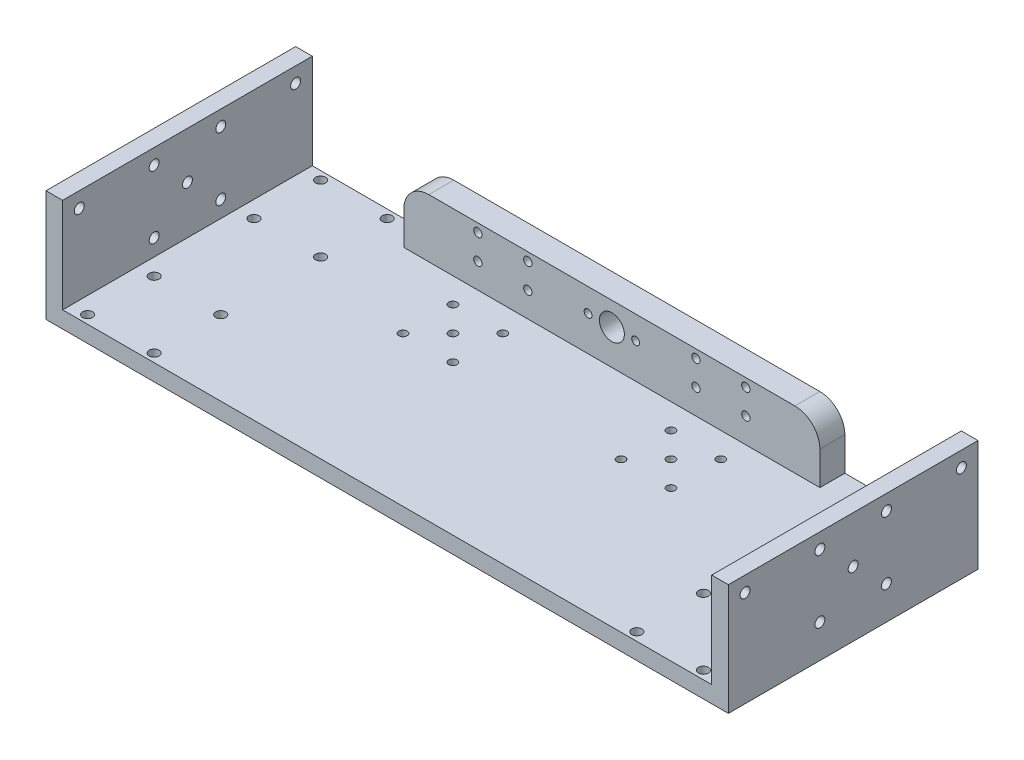
from build123d import *

# Parameters (mm, degrees)
SKETCH1_W            = 410
SKETCH1_H            = 150
SKETCH1_R            = 3
BOSS_EXTRUDE1_DEPTH  = 10
SKETCH2_W            = 10
SKETCH2_H            = 150
BOSS_EXTRUDE3_DEPTH  = 60
SKETCH3_W            = 250
SKETCH3_H            = 10
BOSS_EXTRUDE4_DEPTH  = 60
FILLET2_R            = 25
SKETCH4_R            = 7.5
CUT_EXTRUDE1_DEPTH   = 60
SKETCH5_R            = 3
CUT_EXTRUDE2_DEPTH   = 500
SKETCH6_R            = 3
CUT_EXTRUDE3_DEPTH   = 10
SKETCH7_R            = 3
BOSS_EXTRUDE5_DEPTH  = 10
CUT_EXTRUDE4_START   = -10
SKETCH8_R            = 3
CUT_EXTRUDE4_DEPTH   = 10
BOSS_EXTRUDE6_START  = -10
SKETCH9_R            = 3
BOSS_EXTRUDE6_DEPTH  = 10
SKETCH10_W           = 150
SKETCH10_H           = 3
CUT_EXTRUDE5_DEPTH   = 600
SKETCH11_R           = 2.5
CUT_EXTRUDE6_DEPTH   = 448.759980347
SKETCH12_R           = 2.5
CUT_EXTRUDE7_DEPTH   = 10
SKETCH14_R           = 2.5
CUT_EXTRUDE8_DEPTH   = 10
SKETCH16_R           = 2.5
CUT_EXTRUDE9_DEPTH   = 10
SKETCH17_R           = 2.5
BOSS_EXTRUDE7_DEPTH  = 10
SKETCH18_R           = 2.5
SKETCH18_R_2         = 7.5
BOSS_EXTRUDE8_DEPTH  = 5
FILLET3_R            = 22
FILLET4_R            = 22
BOSS_EXTRUDE9_DEPTH  = 5
CUT_EXTRUDE11_DEPTH  = 5
CUT_EXTRUDE12_START  = -5
SKETCH21_R           = 2.5
SKETCH21_R_2         = 7.5
CUT_EXTRUDE12_DEPTH  = 5
BOSS_EXTRUDE10_START = 5
SKETCH22_W           = 250
SKETCH22_H           = 57
SKETCH22_R           = 2.5
SKETCH22_R_2         = 7.5
BOSS_EXTRUDE10_DEPTH = 5
FILLET5_R            = 22
SKETCH23_R           = 2.5
BOSS_EXTRUDE12_DEPTH = 5
SKETCH24_R           = 2.5
BOSS_EXTRUDE13_DEPTH = 10
CUT_EXTRUDE19_START  = -10
SKETCH25_R           = 2.5
CUT_EXTRUDE19_DEPTH  = 10
SKETCH27_W           = 250
SKETCH27_H           = 15
CUT_EXTRUDE20_DEPTH  = 22
SKETCH28_R           = 2.5
CUT_EXTRUDE21_DEPTH  = 22
FILLET6_R            = 15
FILLET7_R            = 15
SKETCH30_R           = 2.5
SKETCH30_R_2         = 2.34
BOSS_EXTRUDE15_DEPTH = 15
SKETCH32_R           = 2.5
BOSS_EXTRUDE17_DEPTH = 15


with BuildPart() as part:
    # Sketch1 → Boss-Extrude1 (new body)
    with BuildSketch(Plane(origin=(0, 0, 0), x_dir=(1, 0, 0), z_dir=(0, 1, 0))):
        with Locations((215, 75)):
            Rectangle(SKETCH1_W, SKETCH1_H)
        with Locations(Location((30, 5, 0), (0, 0, 270))):
            Circle(SKETCH1_R, mode=Mode.SUBTRACT)
        with Locations(Location((70, 5, 0), (0, 0, 270))):
            Circle(SKETCH1_R, mode=Mode.SUBTRACT)
        with Locations(Location((30, 45, 0), (0, 0, 270))):
            Circle(SKETCH1_R, mode=Mode.SUBTRACT)
        with Locations(Location((70, 45, 0), (0, 0, 270))):
            Circle(SKETCH1_R, mode=Mode.SUBTRACT)
        with Locations(Location((360, 5, 0), (0, 0, 270))):
            Circle(SKETCH1_R, mode=Mode.SUBTRACT)
        with Locations(Location((400, 5, 0), (0, 0, 270))):
            Circle(SKETCH1_R, mode=Mode.SUBTRACT)
        with Locations(Location((360, 45, 0), (0, 0, 270))):
            Circle(SKETCH1_R, mode=Mode.SUBTRACT)
        with Locations(Location((400, 45, 0), (0, 0, 270))):
            Circle(SKETCH1_R, mode=Mode.SUBTRACT)
        with Locations(Location((30, 105, 0), (0, 0, 270))):
            Circle(SKETCH1_R, mode=Mode.SUBTRACT)
        with Locations(Location((70, 105, 0), (0, 0, 270))):
            Circle(SKETCH1_R, mode=Mode.SUBTRACT)
        with Locations(Location((30, 145, 0), (0, 0, 270))):
            Circle(SKETCH1_R, mode=Mode.SUBTRACT)
        with Locations(Location((70, 145, 0), (0, 0, 270))):
            Circle(SKETCH1_R, mode=Mode.SUBTRACT)
        with Locations(Location((360, 105, 0), (0, 0, 270))):
            Circle(SKETCH1_R, mode=Mode.SUBTRACT)
        with Locations(Location((400, 105, 0), (0, 0, 270))):
            Circle(SKETCH1_R, mode=Mode.SUBTRACT)
        with Locations(Location((360, 145, 0), (0, 0, 270))):
            Circle(SKETCH1_R, mode=Mode.SUBTRACT)
        with Locations(Location((400, 145, 0), (0, 0, 270))):
            Circle(SKETCH1_R, mode=Mode.SUBTRACT)
    extrude(amount=BOSS_EXTRUDE1_DEPTH)

    # Sketch2 → Boss-Extrude3 (add)
    with BuildSketch(Plane(origin=(0, 10, 0), x_dir=(1, 0, 0), z_dir=(0, 1, 0))):
        with Locations((15, 75)):
            Rectangle(SKETCH2_W, SKETCH2_H)
        with Locations((415, 75)):
            Rectangle(SKETCH2_W, SKETCH2_H)
    extrude(amount=BOSS_EXTRUDE3_DEPTH)

    # Sketch3 → Boss-Extrude4 (add)
    with BuildSketch(Plane(origin=(0, 10, 0), x_dir=(1, 0, 0), z_dir=(0, 1, 0))):
        with Locations((215, 145)):
            Rectangle(SKETCH3_W, SKETCH3_H)
    extrude(amount=BOSS_EXTRUDE4_DEPTH)

    # Fillet2
    fillet2_edges = [part.edges().sort_by_distance(p)[0] for p in [
        (340, 70, -145),
        (90, 70, -145),
    ]]
    fillet(fillet2_edges, radius=FILLET2_R)

    # Sketch4 → Cut-Extrude1 (cut)
    with BuildSketch(Plane.XY.offset(-140)):
        with Locations((215, 31)):
            Circle(SKETCH4_R)
    extrude(amount=-CUT_EXTRUDE1_DEPTH, mode=Mode.SUBTRACT)

    # Sketch5 → Cut-Extrude2 (cut)
    with BuildSketch(Plane(origin=(420, 0, 0), x_dir=(0, 0, -1), z_dir=(1, 0, 0))):
        with Locations((10, 57.828527729)):
            Circle(SKETCH5_R)
        with Locations((55, 57.828527729)):
            Circle(SKETCH5_R)
        with Locations((95, 57.828527729)):
            Circle(SKETCH5_R)
        with Locations((130, 57.828527729)):
            Circle(SKETCH5_R)
        with Locations((75, 38.914263864)):
            Circle(SKETCH5_R)
        with Locations((95, 20)):
            Circle(SKETCH5_R)
        with Locations((55, 20)):
            Circle(SKETCH5_R)
    extrude(amount=-CUT_EXTRUDE2_DEPTH, mode=Mode.SUBTRACT)

    # Sketch6 → Cut-Extrude3 (cut)
    with BuildSketch(Plane(origin=(420, 0, 0), x_dir=(0, 0, -1), z_dir=(1, 0, 0))):
        with Locations((140, 57.828527729)):
            Circle(SKETCH6_R)
    extrude(amount=-CUT_EXTRUDE3_DEPTH, mode=Mode.SUBTRACT)

    # Sketch7 → Boss-Extrude5 (add)
    with BuildSketch(Plane(origin=(420, 0, 0), x_dir=(0, 0, -1), z_dir=(1, 0, 0))):
        with Locations((130, 57.828527729)):
            Circle(SKETCH7_R)
    extrude(amount=-BOSS_EXTRUDE5_DEPTH)

    # Sketch8 → Cut-Extrude4 (cut)
    with BuildSketch(Plane.ZY.offset(-10).offset(CUT_EXTRUDE4_START)):
        with Locations(Location((-140, 57.828527729, 0), (0, 0, 180))):
            Circle(SKETCH8_R)
    extrude(amount=CUT_EXTRUDE4_DEPTH, mode=Mode.SUBTRACT)

    # Sketch9 → Boss-Extrude6 (add)
    with BuildSketch(Plane.ZY.offset(-10).offset(BOSS_EXTRUDE6_START)):
        with Locations((-130, 57.828527729)):
            Circle(SKETCH9_R)
    extrude(amount=BOSS_EXTRUDE6_DEPTH)

    # Sketch10 → Cut-Extrude5 (cut)
    with BuildSketch(Plane.ZY.offset(-10)):
        with Locations((-75, 68.5)):
            Rectangle(SKETCH10_W, SKETCH10_H)
    extrude(amount=-CUT_EXTRUDE5_DEPTH, mode=Mode.SUBTRACT)

    # Sketch11 → Cut-Extrude6 (cut, through all)
    with BuildSketch(Plane.XY.offset(-140)):
        with Locations((200.72, 31)):
            Circle(SKETCH11_R)
        with Locations((229.28, 31)):
            Circle(SKETCH11_R)
    extrude(amount=-CUT_EXTRUDE6_DEPTH, mode=Mode.SUBTRACT)

    # Sketch12 → Cut-Extrude7 (cut)
    with BuildSketch(Plane.XY.offset(-140)):
        with Locations((134.5, 55)):
            Circle(SKETCH12_R)
        with Locations((164.5, 55)):
            Circle(SKETCH12_R)
        with Locations((149.5, 40)):
            Circle(SKETCH12_R)
        with Locations((134.5, 25)):
            Circle(SKETCH12_R)
        with Locations((164.5, 25)):
            Circle(SKETCH12_R)
        with Locations((265.5, 55)):
            Circle(SKETCH12_R)
        with Locations((295.5, 55)):
            Circle(SKETCH12_R)
        with Locations((280.5, 40)):
            Circle(SKETCH12_R)
        with Locations((295.5, 25)):
            Circle(SKETCH12_R)
        with Locations((265.5, 25)):
            Circle(SKETCH12_R)
    extrude(amount=-CUT_EXTRUDE7_DEPTH, mode=Mode.SUBTRACT)

    # Sketch14 → Cut-Extrude8 (cut)
    with BuildSketch(Plane(origin=(0, 10, 0), x_dir=(1, 0, 0), z_dir=(0, 1, 0))):
        with Locations(Location((144.5, 125, 0), (0, 0, 270))):
            Circle(SKETCH14_R)
        with Locations(Location((174.5, 125, 0), (0, 0, 270))):
            Circle(SKETCH14_R)
        with Locations(Location((159.5, 110, 0), (0, 0, 270))):
            Circle(SKETCH14_R)
        with Locations(Location((174.5, 95, 0), (0, 0, 270))):
            Circle(SKETCH14_R)
        with Locations(Location((144.5, 95, 0), (0, 0, 270))):
            Circle(SKETCH14_R)
        with Locations(Location((255.5, 125, 0), (0, 0, 270))):
            Circle(SKETCH14_R)
        with Locations(Location((285.5, 125, 0), (0, 0, 270))):
            Circle(SKETCH14_R)
        with Locations(Location((270.5, 110, 0), (0, 0, 270))):
            Circle(SKETCH14_R)
        with Locations(Location((255.5, 95, 0), (0, 0, 270))):
            Circle(SKETCH14_R)
        with Locations(Location((285.5, 95, 0), (0, 0, 270))):
            Circle(SKETCH14_R)
    extrude(amount=-CUT_EXTRUDE8_DEPTH, mode=Mode.SUBTRACT)

    # Sketch16 → Cut-Extrude9 (cut)
    with BuildSketch(Plane(origin=(0, 10, 0), x_dir=(1, 0, 0), z_dir=(0, 1, 0))):
        with Locations(Location((164.5, 125, 0), (0, 0, 270))):
            Circle(SKETCH16_R)
        with Locations(Location((149.5, 110, 0), (0, 0, 270))):
            Circle(SKETCH16_R)
        with Locations(Location((164.5, 95, 0), (0, 0, 270))):
            Circle(SKETCH16_R)
        with Locations(Location((134.5, 95, 0), (0, 0, 270))):
            Circle(SKETCH16_R)
        with Locations(Location((134.5, 125, 0), (0, 0, 270))):
            Circle(SKETCH16_R)
        with Locations(Location((265.5, 125, 0), (0, 0, 270))):
            Circle(SKETCH16_R)
        with Locations(Location((280.5, 110, 0), (0, 0, 270))):
            Circle(SKETCH16_R)
        with Locations(Location((295.5, 125, 0), (0, 0, 270))):
            Circle(SKETCH16_R)
        with Locations(Location((265.5, 95, 0), (0, 0, 270))):
            Circle(SKETCH16_R)
        with Locations(Location((295.5, 95, 0), (0, 0, 270))):
            Circle(SKETCH16_R)
    extrude(amount=-CUT_EXTRUDE9_DEPTH, mode=Mode.SUBTRACT)

    # Sketch17 → Boss-Extrude7 (add)
    with BuildSketch(Plane(origin=(0, 10, 0), x_dir=(1, 0, 0), z_dir=(0, 1, 0))):
        with Locations((144.5, 125)):
            Circle(SKETCH17_R)
        with Locations((174.5, 125)):
            Circle(SKETCH17_R)
        with Locations((159.5, 110)):
            Circle(SKETCH17_R)
        with Locations((144.5, 95)):
            Circle(SKETCH17_R)
        with Locations((174.5, 95)):
            Circle(SKETCH17_R)
        with Locations((285.5, 125)):
            Circle(SKETCH17_R)
        with Locations((255.5, 125)):
            Circle(SKETCH17_R)
        with Locations((270.5, 110)):
            Circle(SKETCH17_R)
        with Locations((255.5, 95)):
            Circle(SKETCH17_R)
        with Locations((285.5, 95)):
            Circle(SKETCH17_R)
    extrude(amount=-BOSS_EXTRUDE7_DEPTH)

    # Sketch18 → Boss-Extrude8 (add)
    with BuildSketch(Plane(origin=(0, 0, -150), x_dir=(-1, 0, 0), z_dir=(0, 0, -1))):
        Polygon((-340, 10), (-410, 10), (-410, 67), (-420, 67), (-420, 0), (-10, 0), (-10, 67), (-20, 67), (-20, 10), (-90, 10), (-90, 67), (-340, 67), align=None)
        with Locations(Location((-295.5, 55, 0), (0, 0, 180))):
            Circle(SKETCH18_R, mode=Mode.SUBTRACT)
        with Locations(Location((-280.5, 40, 0), (0, 0, 180))):
            Circle(SKETCH18_R, mode=Mode.SUBTRACT)
        with Locations(Location((-265.5, 55, 0), (0, 0, 180))):
            Circle(SKETCH18_R, mode=Mode.SUBTRACT)
        with Locations(Location((-295.5, 25, 0), (0, 0, 180))):
            Circle(SKETCH18_R, mode=Mode.SUBTRACT)
        with Locations(Location((-265.5, 25, 0), (0, 0, 180))):
            Circle(SKETCH18_R, mode=Mode.SUBTRACT)
        with Locations(Location((-229.28, 31, 0), (0, 0, 180))):
            Circle(SKETCH18_R, mode=Mode.SUBTRACT)
        with Locations(Location((-215, 31, 0), (0, 0, 180))):
            Circle(SKETCH18_R_2, mode=Mode.SUBTRACT)
        with Locations(Location((-200.72, 31, 0), (0, 0, 180))):
            Circle(SKETCH18_R, mode=Mode.SUBTRACT)
        with Locations(Location((-164.5, 55, 0), (0, 0, 180))):
            Circle(SKETCH18_R, mode=Mode.SUBTRACT)
        with Locations(Location((-134.5, 55, 0), (0, 0, 180))):
            Circle(SKETCH18_R, mode=Mode.SUBTRACT)
        with Locations(Location((-149.5, 40, 0), (0, 0, 180))):
            Circle(SKETCH18_R, mode=Mode.SUBTRACT)
        with Locations(Location((-134.5, 25, 0), (0, 0, 180))):
            Circle(SKETCH18_R, mode=Mode.SUBTRACT)
        with Locations(Location((-164.5, 25, 0), (0, 0, 180))):
            Circle(SKETCH18_R, mode=Mode.SUBTRACT)
    extrude(amount=BOSS_EXTRUDE8_DEPTH)

    # Fillet3
    # the kernel refuses this fillet: 22 mm, written as the material it takes off along each edge
    with BuildSketch(Plane(origin=(340, 67, -95), x_dir=(0, -1, 0), z_dir=(0, 0, -1))) as fillet3_piece_1:
        with BuildLine():
            CenterArc((FILLET3_R, FILLET3_R), FILLET3_R, 180, 90)
            Line((0, FILLET3_R), (0, 0))
            Line((0, 0), (FILLET3_R, 0))
        make_face()
    extrude(amount=115, mode=Mode.SUBTRACT)

    # Fillet4
    # the kernel refuses this fillet: 22 mm, written as the material it takes off along each edge
    with BuildSketch(Plane(origin=(90, 67, -95), x_dir=(0, -1, 0), z_dir=(0, 0, -1))) as fillet4_piece_1:
        with BuildLine():
            CenterArc((FILLET4_R, -FILLET4_R), FILLET4_R, 90, 90)
            Line((0, -FILLET4_R), (0, 0))
            Line((0, 0), (FILLET4_R, 0))
        make_face()
    extrude(amount=115, mode=Mode.SUBTRACT)

    # Sketch19 → Boss-Extrude9 (add)
    with BuildSketch(Plane.XY):
        Polygon((10, 67), (20, 67), (20, 10), (410, 10), (410, 67), (420, 67), (420, 0), (10, 0), align=None)
    extrude(amount=BOSS_EXTRUDE9_DEPTH)

    # Sketch20 → Cut-Extrude11 (cut)
    with BuildSketch(Plane.XY.offset(5)):
        Polygon((10, 67), (20, 67), (20, 10), (410, 10), (410, 67), (420, 67), (420, 0), (10, 0), align=None)
    extrude(amount=-CUT_EXTRUDE11_DEPTH, mode=Mode.SUBTRACT)

    # Sketch21 → Cut-Extrude12 (cut)
    with BuildSketch(Plane(origin=(0, 0, -155), x_dir=(-1, 0, 0), z_dir=(0, 0, -1)).offset(CUT_EXTRUDE12_START)):
        Polygon((-420, 67), (-410, 67), (-410, 10), (-340, 10), (-340, 67), (-90, 67), (-90, 10), (-20, 10), (-20, 67), (-10, 67), (-10, 0), (-420, 0), align=None)
        with Locations(Location((-295.5, 55, 0), (0, 0, 180))):
            Circle(SKETCH21_R, mode=Mode.SUBTRACT)
        with Locations(Location((-265.5, 55, 0), (0, 0, 180))):
            Circle(SKETCH21_R, mode=Mode.SUBTRACT)
        with Locations(Location((-215, 31, 0), (0, 0, 180))):
            Circle(SKETCH21_R_2, mode=Mode.SUBTRACT)
        with Locations(Location((-200.72, 31, 0), (0, 0, 180))):
            Circle(SKETCH21_R, mode=Mode.SUBTRACT)
        with Locations(Location((-229.28, 31, 0), (0, 0, 180))):
            Circle(SKETCH21_R, mode=Mode.SUBTRACT)
        with Locations(Location((-265.5, 25, 0), (0, 0, 180))):
            Circle(SKETCH21_R, mode=Mode.SUBTRACT)
        with Locations(Location((-280.5, 40, 0), (0, 0, 180))):
            Circle(SKETCH21_R, mode=Mode.SUBTRACT)
        with Locations(Location((-295.5, 25, 0), (0, 0, 180))):
            Circle(SKETCH21_R, mode=Mode.SUBTRACT)
        with Locations(Location((-164.5, 55, 0), (0, 0, 180))):
            Circle(SKETCH21_R, mode=Mode.SUBTRACT)
        with Locations(Location((-149.5, 40, 0), (0, 0, 180))):
            Circle(SKETCH21_R, mode=Mode.SUBTRACT)
        with Locations(Location((-164.5, 25, 0), (0, 0, 180))):
            Circle(SKETCH21_R, mode=Mode.SUBTRACT)
        with Locations(Location((-134.5, 25, 0), (0, 0, 180))):
            Circle(SKETCH21_R, mode=Mode.SUBTRACT)
        with Locations(Location((-134.5, 55, 0), (0, 0, 180))):
            Circle(SKETCH21_R, mode=Mode.SUBTRACT)
    extrude(amount=CUT_EXTRUDE12_DEPTH, mode=Mode.SUBTRACT)

    # Sketch22 → Boss-Extrude10 (add)
    with BuildSketch(Plane.XY.offset(-140).offset(BOSS_EXTRUDE10_START)):
        with Locations((215, 38.5)):
            Rectangle(SKETCH22_W, SKETCH22_H)
        with Locations((134.5, 55)):
            Circle(SKETCH22_R, mode=Mode.SUBTRACT)
        with Locations((164.5, 55)):
            Circle(SKETCH22_R, mode=Mode.SUBTRACT)
        with Locations((149.5, 40)):
            Circle(SKETCH22_R, mode=Mode.SUBTRACT)
        with Locations((164.5, 25)):
            Circle(SKETCH22_R, mode=Mode.SUBTRACT)
        with Locations((134.5, 25)):
            Circle(SKETCH22_R, mode=Mode.SUBTRACT)
        with Locations((215, 31)):
            Circle(SKETCH22_R_2, mode=Mode.SUBTRACT)
        with Locations((229.28, 31)):
            Circle(SKETCH22_R, mode=Mode.SUBTRACT)
        with Locations((200.72, 31)):
            Circle(SKETCH22_R, mode=Mode.SUBTRACT)
        with Locations((265.5, 55)):
            Circle(SKETCH22_R, mode=Mode.SUBTRACT)
        with Locations((280.5, 40)):
            Circle(SKETCH22_R, mode=Mode.SUBTRACT)
        with Locations((295.5, 55)):
            Circle(SKETCH22_R, mode=Mode.SUBTRACT)
        with Locations((295.5, 25)):
            Circle(SKETCH22_R, mode=Mode.SUBTRACT)
        with Locations((265.5, 25)):
            Circle(SKETCH22_R, mode=Mode.SUBTRACT)
    extrude(amount=-BOSS_EXTRUDE10_DEPTH)

    # Fillet5
    fillet5_edges = [part.edges().sort_by_distance(p)[0] for p in [
        (90, 67, -137.5),
        (340, 67, -137.5),
    ]]
    fillet(fillet5_edges, radius=FILLET5_R)

    # Sketch23 → Boss-Extrude12 (add)
    with BuildSketch(Plane(origin=(0, 10, 0), x_dir=(1, 0, 0), z_dir=(0, 1, 0))):
        with Locations(Location((265.5, 120, 0), (0, 0, 90))):
            Circle(SKETCH23_R)
        with Locations(Location((295.5, 120, 0), (0, 0, 90))):
            Circle(SKETCH23_R)
        with Locations(Location((280.5, 105, 0), (0, 0, 90))):
            Circle(SKETCH23_R)
        with Locations(Location((295.5, 90, 0), (0, 0, 90))):
            Circle(SKETCH23_R)
        with Locations(Location((265.5, 90, 0), (0, 0, 90))):
            Circle(SKETCH23_R)
        with Locations(Location((164.5, 120, 0), (0, 0, 90))):
            Circle(SKETCH23_R)
        with Locations(Location((134.5, 120, 0), (0, 0, 90))):
            Circle(SKETCH23_R)
        with Locations(Location((149.5, 105, 0), (0, 0, 90))):
            Circle(SKETCH23_R)
        with Locations(Location((164.5, 90, 0), (0, 0, 90))):
            Circle(SKETCH23_R)
        with Locations(Location((134.5, 90, 0), (0, 0, 90))):
            Circle(SKETCH23_R)
    extrude(amount=BOSS_EXTRUDE12_DEPTH)

    # Sketch24 → Boss-Extrude13 (add)
    with BuildSketch(Plane(origin=(0, 10, 0), x_dir=(1, 0, 0), z_dir=(0, 1, 0))):
        with Locations((295.5, 125)):
            Circle(SKETCH24_R)
        with Locations((265.5, 125)):
            Circle(SKETCH24_R)
        with Locations((280.5, 110)):
            Circle(SKETCH24_R)
        with Locations((295.5, 95)):
            Circle(SKETCH24_R)
        with Locations((265.5, 95)):
            Circle(SKETCH24_R)
        with Locations((164.5, 125)):
            Circle(SKETCH24_R)
        with Locations((134.5, 125)):
            Circle(SKETCH24_R)
        with Locations((149.5, 110)):
            Circle(SKETCH24_R)
        with Locations((164.5, 95)):
            Circle(SKETCH24_R)
        with Locations((134.5, 95)):
            Circle(SKETCH24_R)
    extrude(amount=-BOSS_EXTRUDE13_DEPTH)

    # Sketch25 → Cut-Extrude19 (cut)
    with BuildSketch(Plane(origin=(0, 10, 0), x_dir=(1, 0, 0), z_dir=(0, 1, 0)).offset(CUT_EXTRUDE19_START)):
        with Locations(Location((134.5, 120, 0), (0, 0, 270))):
            Circle(SKETCH25_R)
        with Locations(Location((164.5, 120, 0), (0, 0, 270))):
            Circle(SKETCH25_R)
        with Locations(Location((149.5, 105, 0), (0, 0, 270))):
            Circle(SKETCH25_R)
        with Locations(Location((164.5, 90, 0), (0, 0, 270))):
            Circle(SKETCH25_R)
        with Locations(Location((134.5, 90, 0), (0, 0, 270))):
            Circle(SKETCH25_R)
        with Locations(Location((265.5, 120, 0), (0, 0, 270))):
            Circle(SKETCH25_R)
        with Locations(Location((295.5, 120, 0), (0, 0, 270))):
            Circle(SKETCH25_R)
        with Locations(Location((280.5, 105, 0), (0, 0, 270))):
            Circle(SKETCH25_R)
        with Locations(Location((295.5, 90, 0), (0, 0, 270))):
            Circle(SKETCH25_R)
        with Locations(Location((265.5, 90, 0), (0, 0, 270))):
            Circle(SKETCH25_R)
    extrude(amount=CUT_EXTRUDE19_DEPTH, mode=Mode.SUBTRACT)


with BuildPart() as cut_extrude19_kept_piece:
    # of the separate pieces the step leaves, the one the design keeps (cut_extrude19_pieces_kept)
    add(part.part.solids().sort_by_distance((340, 45, -135))[0])

    # Sketch27 → Cut-Extrude20 (cut)
    with BuildSketch(Plane(origin=(0, 67, 0), x_dir=(1, 0, 0), z_dir=(0, 1, 0))):
        with Locations((215, 142.5)):
            Rectangle(SKETCH27_W, SKETCH27_H)
    extrude(amount=-CUT_EXTRUDE20_DEPTH, mode=Mode.SUBTRACT)

    # Sketch28 → Cut-Extrude21 (cut)
    with BuildSketch(Plane.XY.offset(-135)):
        with Locations((265.5, 40)):
            Circle(SKETCH28_R)
        with Locations((295.5, 40)):
            Circle(SKETCH28_R)
        with Locations((134.5, 40)):
            Circle(SKETCH28_R)
        with Locations((164.5, 40)):
            Circle(SKETCH28_R)
    extrude(amount=-CUT_EXTRUDE21_DEPTH, mode=Mode.SUBTRACT)

    # Fillet6
    fillet6_edges = [cut_extrude19_kept_piece.edges().sort_by_distance(p)[0] for p in [
        (90, 45, -142.5),
    ]]
    fillet(fillet6_edges, radius=FILLET6_R)

    # Fillet7
    fillet7_edges = [cut_extrude19_kept_piece.edges().sort_by_distance(p)[0] for p in [
        (340, 45, -142.5),
    ]]
    fillet(fillet7_edges, radius=FILLET7_R)

    # Sketch30 → Boss-Extrude15 (add, through all)
    # profile 1 of 2: a face of its own
    with BuildSketch(Plane.XY.offset(-135)):
        with Locations((200.72, 31)):
            Circle(SKETCH30_R)
        with Locations((200.72, 31)):
            Circle(SKETCH30_R_2, mode=Mode.SUBTRACT)
    # profile 2 of 2: a face of its own
    with BuildSketch(Plane.XY.offset(-135)):
        with Locations((229.28, 31)):
            Circle(SKETCH30_R)
        with Locations((229.28, 31)):
            Circle(SKETCH30_R_2, mode=Mode.SUBTRACT)
    extrude(amount=-BOSS_EXTRUDE15_DEPTH)

    # Sketch32 → Boss-Extrude17 (add, through all)
    with BuildSketch(Plane.XY.offset(-135)):
        with Locations((149.5, 40)):
            Circle(SKETCH32_R)
        with Locations((280.5, 40)):
            Circle(SKETCH32_R)
    extrude(amount=-BOSS_EXTRUDE17_DEPTH)


solid = cut_extrude19_kept_piece.part
